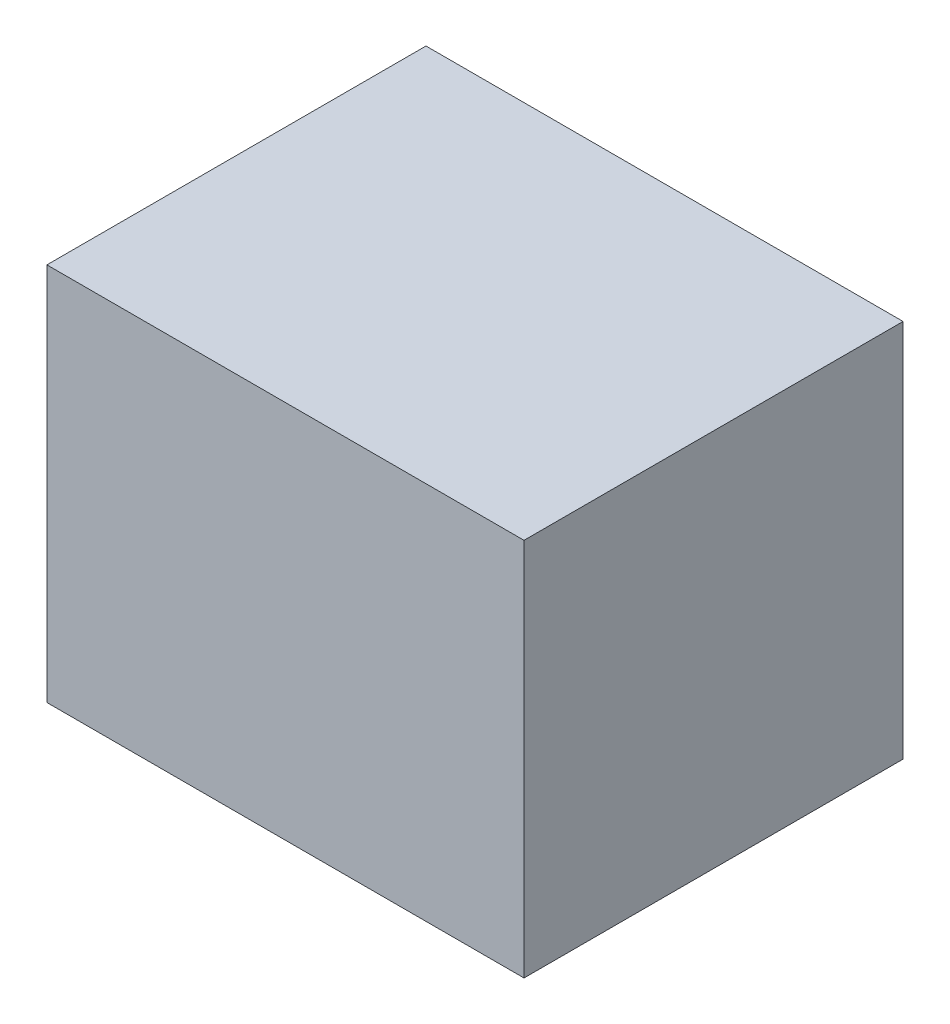
from build123d import *

# Parameters (mm, degrees)
SKETCH1_W           = 1460
SKETCH1_H           = 1160
BOSS_EXTRUDE1_DEPTH = 1160


with BuildPart() as part:
    # Sketch1 → Boss-Extrude1 (new body)
    with BuildSketch(Plane.XY):
        Rectangle(SKETCH1_W, SKETCH1_H)
    extrude(amount=BOSS_EXTRUDE1_DEPTH)


solid = part.part
